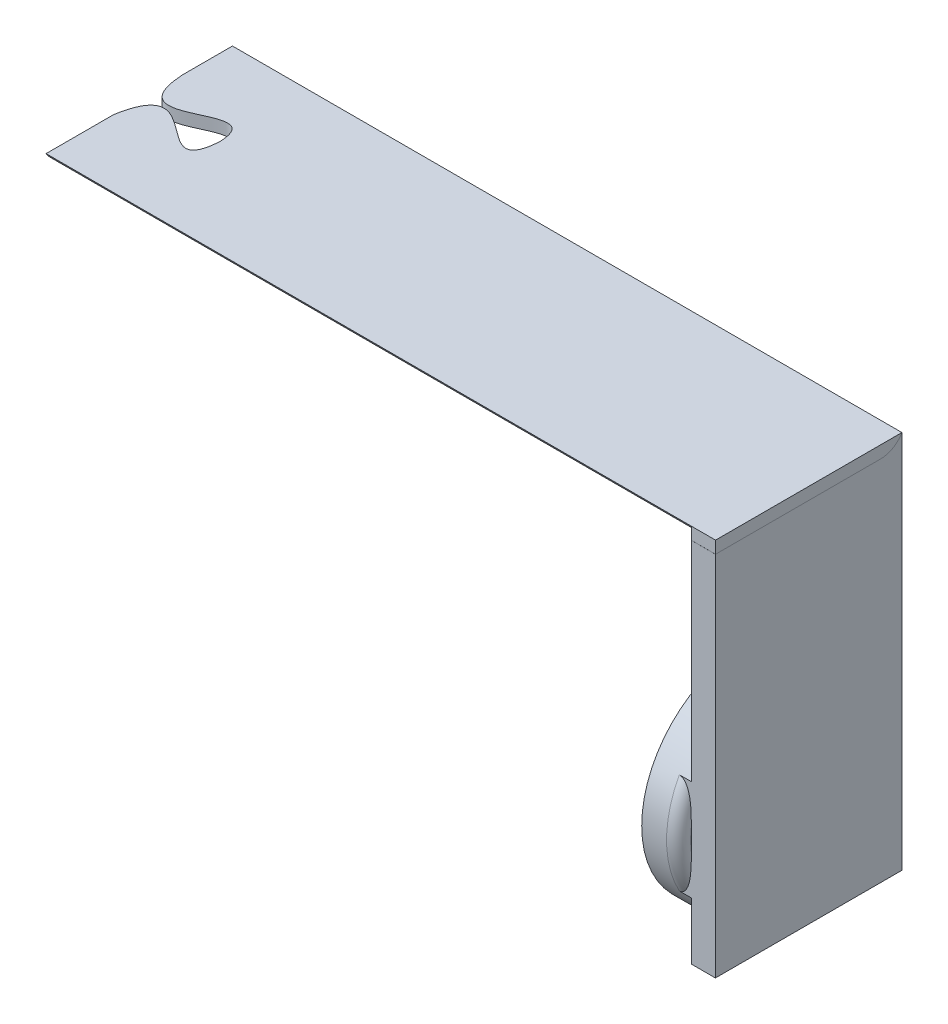
from build123d import *

# Parameters (mm, degrees)
BOSS_EXTRUDE1_DEPTH = 2.54
BOSS_EXTRUDE2_DEPTH = 76.2
SKETCH6_R           = 22
SKETCH6_R_2         = 18.600000000000005
BOSS_EXTRUDE5_DEPTH = 7.660427645478581
FILLET10_R          = 2.5
FILLET11_R          = 2.5
FILLET13_R          = 5.57093307
FILLET15_R          = 5.08
FILLET16_R          = 5.08


with BuildPart() as part:
    # Sketch1 → Boss-Extrude1 (new body)
    with BuildSketch(Plane(origin=(0, 0, 0), x_dir=(1, 0, 0), z_dir=(0, 1, 0))):
        with BuildLine():
            Line((0, 28.293848376378605), (0, 38.694970839027235))
            Line((0, 38.694970839027235), (139, 38.694970839027235))
            Line((139, 38.694970839027235), (139, 0))
            Line((139, 0), (0, 0))
            Line((0, 0), (0, 14.045240588338004))
            add(Edge.make_bspline(
                [(0, 14.045240588338004), (3.0899762489281395, 31.623018189199616), (14.68245796656543, 5.677642965238619), (15.876552294634884, 19.936564793057386)],
                knots=[0, 0, 0, 0, 1, 1, 1, 1], degree=3))
            add(Edge.make_bspline(
                [(0, 28.293848376378605), (1.0033062764081593, 11.15878467888299), (15.658213538640268, 32.998799430672), (15.876552294634884, 19.936564793057386)],
                knots=[0, 0, 0, 0, 1, 1, 1, 1], degree=3))
        make_face()
    extrude(amount=BOSS_EXTRUDE1_DEPTH)

    # Sketch5 → Boss-Extrude2 (add)
    with BuildSketch(Plane.XZ):
        Polygon((138.98190867121684, -38.68428246542061), (133.98190867121684, -38.68428246542061), (133.98190867121684, 0.01068837360662839), (138.98190867121684, 0.010688373606629), align=None)
    extrude(amount=BOSS_EXTRUDE2_DEPTH)

    # Sketch6 → Boss-Extrude5 (add)
    with BuildSketch(Plane.ZY.offset(-133.98190867121684)):
        with Locations(Location((-19.347485419513617, -53.847999999999985, 0), (0, 0, 151.515398593))):
            Circle(SKETCH6_R)
        with Locations((-19.347485419513617, -53.847999999999985)):
            Circle(SKETCH6_R_2, mode=Mode.SUBTRACT)
    extrude(amount=BOSS_EXTRUDE5_DEPTH)

    # Fillet10
    # the kernel refuses this fillet: 2.5 mm, written as the material it takes off along each edge
    with BuildSketch(Plane(origin=(133.98190867121684, -53.847999999999985, -19.347485419513617), x_dir=(0, 0.7041935749471109, -0.7100080344638416), z_dir=(0, 0.7100080344638416, 0.7041935749471109))) as fillet10_piece_1_section:
        with BuildLine():
            CenterArc((22 - FILLET10_R, FILLET10_R), FILLET10_R, 269.9999999999999, 90.00000000000011)
            Line((22 - FILLET10_R, 0), (22, 0))
            Line((22, 0), (22, FILLET10_R))
        make_face()
    fillet10_piece_1 = revolve(axis=Axis((133.98190867121684, -53.847999999999985, -19.347485419513617), (-1, 0, 0)), revolution_arc=89.52886192357941, mode=Mode.PRIVATE)
    fillet10_piece_1 = split(fillet10_piece_1, bisect_by=Plane(origin=(133.27050053527873, -53.847999999999985, -38.68428246542061), z_dir=(0, 0, -1)), keep=Keep.TOP, mode=Mode.PRIVATE)
    add(fillet10_piece_1, mode=Mode.SUBTRACT)

    # Fillet11
    fillet11_edges = [part.edges().sort_by_distance(p)[0] for p in [
        (133.98190867121684, -53.84800000000051, 2.6525145804863826),
    ]]
    fillet(fillet11_edges, radius=FILLET11_R)

    # Fillet13
    # the kernel refuses this fillet: 5.57093307 mm, written as the material it takes off along each edge
    with BuildSketch(Plane(origin=(126.32148102573827, -53.847999999999985, -19.347485419513617), x_dir=(0, 0, 1), z_dir=(0, -1, 0))) as fillet13_piece_1:
        with BuildLine():
            CenterArc((24.170933070445475, -5.130530662517188), FILLET13_R, 112.93516881526322, 67.06483118473678)
            Line((18.600000000000005, -5.130530662517188), (18.488581338591096, -5.130530662517188))
            Line((18.488581338591096, -5.130530662517188), (18.488581338591096, 0))
            Line((18.488581338591096, 0), (18.600000000000005, 0.111418661408905))
            ThreePointArc((18.600000000000005, 0.111418661408905), (20.3, 0.111418661408905), (21.956581338591086, 0.1026106132503628))
            Line((21.956581338591086, 0.1026106132503628), (21.999999999999996, 1.421e-14))
        make_face()
    revolve(axis=Axis((126.32148102573827, -53.847999999999985, -19.347485419513617), (-1, 0, 0)), mode=Mode.SUBTRACT)

    # Fillet15
    # the kernel refuses this fillet: 5.08 mm, written as the material it takes off along each edge
    with BuildSketch(Plane(origin=(-10.998522628063, 0, -38.694970839027235), x_dir=(0, 0, 1), z_dir=(1, 0, 0))) as fillet15_piece_1_section:
        with BuildLine():
            CenterArc((4.3994090512251915, -5.079999999999999), FILLET15_R, 90, 60.00000000000139)
            Line((1.8474e-13, -2.5400000000001057), (0, 0))
            Line((0, 0), (4.3994090512251915, 0))
        make_face()
    fillet15_piece_1 = extrude(amount=160.997045256126, mode=Mode.PRIVATE)
    fillet15_piece_1 = split(fillet15_piece_1, bisect_by=Plane(origin=(133.98190867121684, 0.6664663042665507, -36.831394815078376), z_dir=(-1, 0, 0)), keep=Keep.TOP, mode=Mode.PRIVATE)
    add(fillet15_piece_1, mode=Mode.SUBTRACT)
    with BuildSketch(Plane(origin=(-10.998522628063, 0, -38.694970839027235), x_dir=(0, 0, 1), z_dir=(1, 0, 0))) as fillet15_piece_2_section:
        with BuildLine():
            CenterArc((4.3994090512251915, -5.079999999999999), FILLET15_R, 90, 60.00000000000139)
            Line((1.8474e-13, -2.5400000000001057), (0, 0))
            Line((0, 0), (4.3994090512251915, 0))
        make_face()
    fillet15_piece_2 = extrude(amount=160.997045256126, mode=Mode.PRIVATE)
    fillet15_piece_2 = split(fillet15_piece_2, bisect_by=Plane(origin=(136.48190867121684, 2.530272803909126, -38.68428246542061), z_dir=(0, 0, -1)), keep=Keep.TOP, mode=Mode.PRIVATE)
    add(fillet15_piece_2, mode=Mode.SUBTRACT)
    with BuildSketch(Plane(origin=(-10.998522628063, 0, -38.694970839027235), x_dir=(0, 0, 1), z_dir=(1, 0, 0))) as fillet15_piece_3_section:
        with BuildLine():
            CenterArc((4.3994090512251915, -5.079999999999999), FILLET15_R, 90, 60.00000000000139)
            Line((1.8474e-13, -2.5400000000001057), (0, 0))
            Line((0, 0), (4.3994090512251915, 0))
        make_face()
    fillet15_piece_3 = extrude(amount=160.997045256126, mode=Mode.PRIVATE)
    fillet15_piece_3 = split(fillet15_piece_3, bisect_by=Plane(origin=(138.98190867121684, 0.6664663042665507, -36.831394815078376), z_dir=(1, 0, 0)), keep=Keep.TOP, mode=Mode.PRIVATE)
    add(fillet15_piece_3, mode=Mode.SUBTRACT)

    # Fillet16
    # the kernel refuses this fillet: 5.08 mm, written as the material it takes off along each edge
    with BuildSketch(Plane(origin=(133.98190867121684, 0, 0), x_dir=(0, 0, -1), z_dir=(-1, 0, 0))) as fillet16_piece_1:
        with BuildLine():
            CenterArc((4.399409051225193, -5.079999999999999), FILLET16_R, 90, 60.00000000000139)
            Line((1.8474e-13, -2.5400000000001066), (0, 0))
            Line((0, 0), (4.399409051225193, 0))
        make_face()
    extrude(amount=144.98043129927981, mode=Mode.SUBTRACT)


solid = part.part
